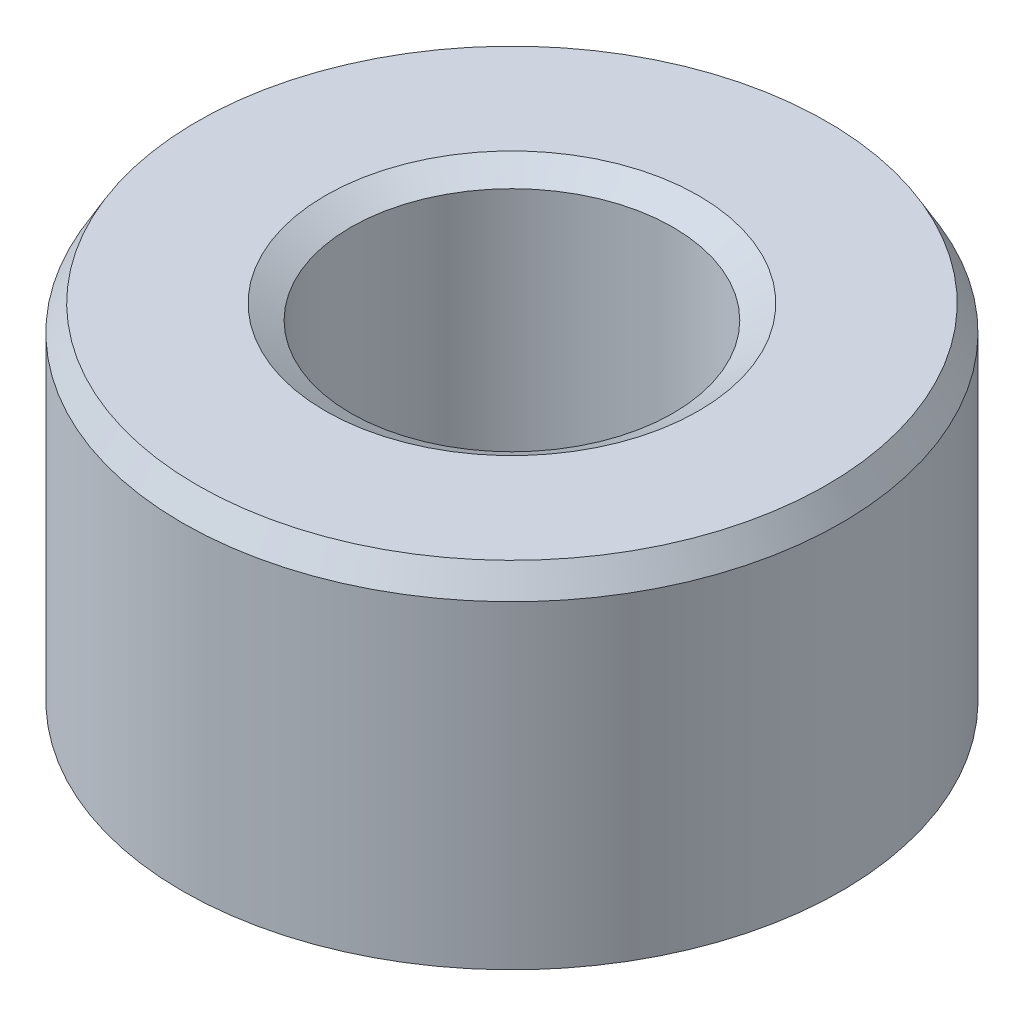
from build123d import *
from OCP.BRepFilletAPI import BRepFilletAPI_MakeChamfer

# Parameters (mm, degrees)
SKETCH1_R           = 30
BOSS_EXTRUDE1_DEPTH = 32.671196372
SKETCH2_R           = 14.666987475
CUT_EXTRUDE1_DEPTH  = 54.548175248
CHAMFER1_SIZE       = 2.318264178
CHAMFER1_SIZE2      = 1.338450447


with BuildPart() as part:
    # Sketch1 → Boss-Extrude1 (new body)
    with BuildSketch(Plane(origin=(0, 0, 0), x_dir=(1, 0, 0), z_dir=(0, 1, 0))):
        Circle(SKETCH1_R)
    extrude(amount=BOSS_EXTRUDE1_DEPTH)

    # Sketch2 → Cut-Extrude1 (cut, through all)
    with BuildSketch(Plane(origin=(0, 0, 0), x_dir=(1, 0, 0), z_dir=(0, 1, 0))):
        Circle(SKETCH2_R)
    extrude(amount=CUT_EXTRUDE1_DEPTH, mode=Mode.SUBTRACT)

    # Chamfer1: one chamfer whose edges measure the first distance from different faces: ONE call of the kernel's chamfer builder (chamfer() names one face for all edges)
    chamfer1_edges_1 = [part.edges().sort_by_distance(p)[0] for p in [
        (-14.666987475, 32.671196372, 0),
    ]]
    chamfer1_side_1 = [part.faces().sort_by_distance(p)[0] for p in [
        (-29.151471863, 32.671196372, 0),
    ]]
    chamfer1_edges_2 = [part.edges().sort_by_distance(p)[0] for p in [
        (-14.666987475, 0, 0),
    ]]
    chamfer1_side_2 = [part.faces().sort_by_distance(p)[0] for p in [
        (-14.666987475, 16.335598186, 0),
    ]]
    chamfer1_edges_3 = [part.edges().sort_by_distance(p)[0] for p in [
        (-30, 0, 0),
    ]]
    chamfer1_side_3 = [part.faces().sort_by_distance(p)[0] for p in [
        (-29.151471863, 0, 0),
    ]]
    chamfer1_edges_4 = [part.edges().sort_by_distance(p)[0] for p in [
        (-30, 32.671196372, 0),
    ]]
    chamfer1_side_4 = [part.faces().sort_by_distance(p)[0] for p in [
        (-30, 16.335598186, 0),
    ]]
    chamfer1 = BRepFilletAPI_MakeChamfer(part.part.solid().wrapped)
    for e in chamfer1_edges_1:
        chamfer1.Add(CHAMFER1_SIZE, CHAMFER1_SIZE2, e.wrapped, chamfer1_side_1[0].wrapped)  # the first distance lies on this face
    for e in chamfer1_edges_2:
        chamfer1.Add(CHAMFER1_SIZE, CHAMFER1_SIZE2, e.wrapped, chamfer1_side_2[0].wrapped)  # the first distance lies on this face
    for e in chamfer1_edges_3:
        chamfer1.Add(CHAMFER1_SIZE, CHAMFER1_SIZE2, e.wrapped, chamfer1_side_3[0].wrapped)  # the first distance lies on this face
    for e in chamfer1_edges_4:
        chamfer1.Add(CHAMFER1_SIZE, CHAMFER1_SIZE2, e.wrapped, chamfer1_side_4[0].wrapped)  # the first distance lies on this face
    add(Compound.cast(chamfer1.Shape()), mode=Mode.REPLACE)


solid = part.part
